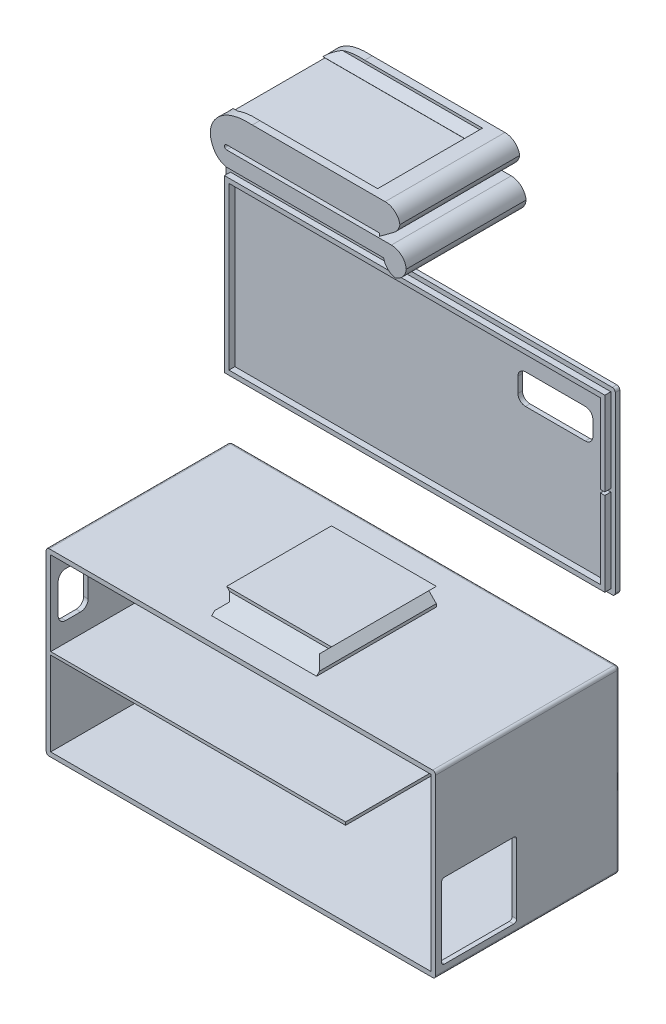
from build123d import *

# Parameters (mm, degrees)
CROQUIS1_W              = 60
CROQUIS1_H              = 130
SALIENTE_EXTRUIR1_DEPTH = 1.5
CROQUIS2_W              = 130
CROQUIS2_H              = 60
CROQUIS2_W_2            = 127
CROQUIS2_H_2            = 28
SALIENTE_EXTRUIR2_DEPTH = 60
CORTAR_EXTRUIR1_DEPTH   = 2
CROQUIS4_W              = 127
CROQUIS4_H              = 6
CROQUIS4_H_2            = 20.4
SALIENTE_EXTRUIR3_DEPTH = 3
CORTAR_EXTRUIR2_DEPTH   = 3
CROQUIS6_W              = 60
CROQUIS6_H              = 130
SALIENTE_EXTRUIR4_DEPTH = 1.5
CROQUIS7_W              = 127
CROQUIS7_H              = 57
CROQUIS7_W_2            = 124
CROQUIS7_H_2            = 54
SALIENTE_EXTRUIR5_DEPTH = 2
CORTAR_EXTRUIR3_DEPTH   = 2
CROQUIS9_W              = 1.5
CROQUIS9_H              = 1.02
CORTAR_EXTRUIR4_DEPTH   = 2
CORTAR_EXTRUIR5_DEPTH   = 2
REDONDEO1_R             = 1
REDONDEO2_R             = 1
CROQUIS11_W             = 35
CROQUIS11_H             = 35
SALIENTE_EXTRUIR8_DEPTH = 6
CORTAR_EXTRUIR7_DEPTH   = 45
CHAFL_N1_SIZE           = 5
SALIENTE_EXTRUIR9_DEPTH = 40
CORTAR_EXTRUIR8_START   = -10
CORTAR_EXTRUIR8_DEPTH   = 60
REDONDEO3_R             = 5


with BuildPart() as part:
    # Croquis1 → Saliente-Extruir1 (new body)
    with BuildSketch(Plane(origin=(0, 0, 0), x_dir=(0, 1, 0), z_dir=(0, 0, 1))):
        Rectangle(CROQUIS1_W, CROQUIS1_H)
    extrude(amount=SALIENTE_EXTRUIR1_DEPTH)

    # Croquis2 → Saliente-Extruir2 (add)
    with BuildSketch(Plane.XY.offset(1.5)):
        Rectangle(CROQUIS2_W, CROQUIS2_H)
        with Locations((0, 14.5)):
            Rectangle(CROQUIS2_W_2, CROQUIS2_H_2, mode=Mode.SUBTRACT)
        with Locations((0, -14.5)):
            Rectangle(CROQUIS2_W_2, CROQUIS2_H_2, mode=Mode.SUBTRACT)
    extrude(amount=SALIENTE_EXTRUIR2_DEPTH)

    # Croquis3 → Cortar-Extruir1 (cut)
    with BuildSketch(Plane(origin=(0, 0.5, 0), x_dir=(-1, 0, 0), z_dir=(0, 1, 0))):
        with BuildLine():
            Line((-63.5, 61.5), (-34.96028162, 61.5))
            Line((-34.96028162, 61.5), (-34.96028162, 31.5))
            ThreePointArc((-34.96028162, 31.5), (-37.889213808, 24.428932188), (-44.96028162, 21.5))
            Line((-44.96028162, 21.5), (-53.5, 21.5))
            ThreePointArc((-53.5, 21.5), (-60.571067812, 24.428932188), (-63.5, 31.5))
            Line((-63.5, 31.5), (-63.5, 61.5))
        make_face()
    extrude(amount=-CORTAR_EXTRUIR1_DEPTH, mode=Mode.SUBTRACT)

    # Croquis4 → Saliente-Extruir3 (add)
    with BuildSketch(Plane.XY.offset(1.5)):
        with Locations((0, -3.5)):
            Rectangle(CROQUIS4_W, CROQUIS4_H)
        with Locations((0, -18.3)):
            Rectangle(CROQUIS4_W, CROQUIS4_H_2)
    extrude(amount=SALIENTE_EXTRUIR3_DEPTH)

    # Croquis5 → Cortar-Extruir2 (cut)
    with BuildSketch(Plane(origin=(-65, 0, 0), x_dir=(0, -1, 0), z_dir=(-1, 0, 0))):
        with BuildLine():
            Line((-9.5, 49), (-19.5, 49))
            ThreePointArc((-19.5, 49), (-21.267766953, 49.732233047), (-22, 51.5))
            Line((-22, 51.5), (-22, 56.5))
            ThreePointArc((-22, 56.5), (-21.267766953, 58.267766953), (-19.5, 59))
            Line((-19.5, 59), (-9.5, 59))
            ThreePointArc((-9.5, 59), (-7.732233047, 58.267766953), (-7, 56.5))
            Line((-7, 56.5), (-7, 51.5))
            ThreePointArc((-7, 51.5), (-7.732233047, 49.732233047), (-9.5, 49))
        make_face()
    extrude(amount=-CORTAR_EXTRUIR2_DEPTH, mode=Mode.SUBTRACT)

    # Croquis10 → Cortar-Extruir5 (cut)
    with BuildSketch(Plane.YZ.offset(65)):
        with BuildLine():
            Line((-2.95, 34.41391254), (-26.05, 34.41391254))
            ThreePointArc((-26.05, 34.41391254), (-26.757106781, 34.706805759), (-27.05, 35.41391254))
            Line((-27.05, 35.41391254), (-27.05, 58.51391254))
            ThreePointArc((-27.05, 58.51391254), (-26.757106781, 59.221019322), (-26.05, 59.51391254))
            Line((-26.05, 59.51391254), (-2.95, 59.51391254))
            ThreePointArc((-2.95, 59.51391254), (-2.242893219, 59.221019322), (-1.95, 58.51391254))
            Line((-1.95, 58.51391254), (-1.95, 35.41391254))
            ThreePointArc((-1.95, 35.41391254), (-2.242893219, 34.706805759), (-2.95, 34.41391254))
        make_face()
    extrude(amount=-CORTAR_EXTRUIR5_DEPTH, mode=Mode.SUBTRACT)

    # Redondeo1
    redondeo1_edges = [part.edges().sort_by_distance(p)[0] for p in [
        (-65, 0, 0),
        (0, 30, 0),
        (65, 0, 0),
        (0, -30, 0),
        (-65, -30, 30.75),
        (-65, 30, 30.75),
        (65, 30, 30.75),
        (65, -30, 30.75),
    ]]
    fillet(redondeo1_edges, radius=REDONDEO1_R)

    # Croquis11 → Saliente-Extruir8 (add)
    with BuildSketch(Plane(origin=(0, 30, 0), x_dir=(-1, 0, 0), z_dir=(0, 1, 0))):
        with Locations((0, 31.25)):
            Rectangle(CROQUIS11_W, CROQUIS11_H)
    extrude(amount=SALIENTE_EXTRUIR8_DEPTH)

    # Croquis15 → Cortar-Extruir7 (cut)
    with BuildSketch(Plane.XY.offset(48.75)):
        Polygon((-17.5, 36), (-15, 33.5), (-17.5, 31), align=None)
    cortar_extruir7 = extrude(amount=-CORTAR_EXTRUIR7_DEPTH, mode=Mode.SUBTRACT)

    # Simetría1: Cortar-Extruir7 across plane
    add(cortar_extruir7.mirror(Plane(origin=(0, 0, 0), x_dir=(0, 0, 1), z_dir=(1, 0, 0))), mode=Mode.SUBTRACT)

    # Chaflán1
    # the kernel refuses this chamfer: 5 mm, written as the material it adds along each edge
    with BuildSketch(Plane(origin=(17.5, 30, 48.75), x_dir=(0, -0.027495876610586317, 0.9996219169112968), z_dir=(-1, 0, 0))) as chafl_n1_piece_1_section:
        Polygon((CHAFL_N1_SIZE * 0.999621916911, CHAFL_N1_SIZE * 0.0274958766106), (-CHAFL_N1_SIZE * 0.0274958766106, CHAFL_N1_SIZE * 0.999621916911), (0, 0), align=None)
    chafl_n1_piece_1 = extrude(amount=35, mode=Mode.PRIVATE)
    chafl_n1_piece_1 = split(chafl_n1_piece_1, bisect_by=Plane(origin=(15.432245285, 33.932245285, 48.975102949), z_dir=(-0.7071067811865482, 0.7071067811865468, 0)), keep=Keep.TOP, mode=Mode.PRIVATE)
    chafl_n1_piece_1 = split(chafl_n1_piece_1, bisect_by=Plane(origin=(14.567754715, 33.932245285, 48.975102949), z_dir=(0.7071067811865462, 0.7071067811865488, 0)), keep=Keep.TOP, mode=Mode.PRIVATE)
    add(chafl_n1_piece_1)
    with BuildSketch(Plane(origin=(17.5, 30, 48.75), x_dir=(0, -0.027495876610586317, 0.9996219169112968), z_dir=(-1, 0, 0))) as chafl_n1_piece_2_section:
        Polygon((CHAFL_N1_SIZE * 0.999621916911, CHAFL_N1_SIZE * 0.0274958766106), (-CHAFL_N1_SIZE * 0.0274958766106, CHAFL_N1_SIZE * 0.999621916911), (0, 0), align=None)
    chafl_n1_piece_2 = extrude(amount=35, mode=Mode.PRIVATE)
    chafl_n1_piece_2 = split(chafl_n1_piece_2, bisect_by=Plane(origin=(13.632899662, 32.132899662, 50.773714866), z_dir=(0.7071067811865482, -0.7071067811865468, 0)), keep=Keep.TOP, mode=Mode.PRIVATE)
    chafl_n1_piece_2 = split(chafl_n1_piece_2, bisect_by=Plane(origin=(16.189237839, 32.310762161, 50.773714866), z_dir=(-0.7071067811865462, -0.7071067811865488, 0)), keep=Keep.TOP, mode=Mode.PRIVATE)
    add(chafl_n1_piece_2)
    with BuildSketch(Plane(origin=(17.5, 30, 48.75), x_dir=(0, -0.027495876610586317, 0.9996219169112968), z_dir=(-1, 0, 0))) as chafl_n1_piece_3_section:
        Polygon((CHAFL_N1_SIZE * 0.999621916911, CHAFL_N1_SIZE * 0.0274958766106), (-CHAFL_N1_SIZE * 0.0274958766106, CHAFL_N1_SIZE * 0.999621916911), (0, 0), align=None)
    chafl_n1_piece_3 = extrude(amount=35, mode=Mode.PRIVATE)
    chafl_n1_piece_3 = split(chafl_n1_piece_3, bisect_by=Plane(origin=(-8.376980727, 40.123019273, 50.346819727), z_dir=(0.7071067811865462, -0.7071067811865488, 0)), keep=Keep.TOP, mode=Mode.PRIVATE)
    chafl_n1_piece_3 = split(chafl_n1_piece_3, bisect_by=Plane(origin=(-6.623019273, 25.123019273, 50.346819727), z_dir=(0.7071067811865482, 0.7071067811865468, 0)), keep=Keep.TOP, mode=Mode.PRIVATE)
    chafl_n1_piece_3 = split(chafl_n1_piece_3, bisect_by=Plane(origin=(6.623019273, 25.123019273, 50.346819727), z_dir=(-0.7071067811865482, 0.7071067811865468, 0)), keep=Keep.TOP, mode=Mode.PRIVATE)
    chafl_n1_piece_3 = split(chafl_n1_piece_3, bisect_by=Plane(origin=(8.376980727, 40.123019273, 50.346819727), z_dir=(-0.7071067811865462, -0.7071067811865488, 0)), keep=Keep.TOP, mode=Mode.PRIVATE)
    add(chafl_n1_piece_3)
    with BuildSketch(Plane(origin=(17.5, 30, 48.75), x_dir=(0, -0.027495876610586317, 0.9996219169112968), z_dir=(-1, 0, 0))) as chafl_n1_piece_4_section:
        Polygon((CHAFL_N1_SIZE * 0.999621916911, CHAFL_N1_SIZE * 0.0274958766106), (-CHAFL_N1_SIZE * 0.0274958766106, CHAFL_N1_SIZE * 0.999621916911), (0, 0), align=None)
    chafl_n1_piece_4 = extrude(amount=35, mode=Mode.PRIVATE)
    chafl_n1_piece_4 = split(chafl_n1_piece_4, bisect_by=Plane(origin=(-14.567754715, 33.932245285, 48.975102949), z_dir=(-0.7071067811865462, 0.7071067811865488, 0)), keep=Keep.TOP, mode=Mode.PRIVATE)
    chafl_n1_piece_4 = split(chafl_n1_piece_4, bisect_by=Plane(origin=(-15.432245285, 33.932245285, 48.975102949), z_dir=(0.7071067811865482, 0.7071067811865468, 0)), keep=Keep.TOP, mode=Mode.PRIVATE)
    add(chafl_n1_piece_4)
    with BuildSketch(Plane(origin=(17.5, 30, 48.75), x_dir=(0, -0.027495876610586317, 0.9996219169112968), z_dir=(-1, 0, 0))) as chafl_n1_piece_5_section:
        Polygon((CHAFL_N1_SIZE * 0.999621916911, CHAFL_N1_SIZE * 0.0274958766106), (-CHAFL_N1_SIZE * 0.0274958766106, CHAFL_N1_SIZE * 0.999621916911), (0, 0), align=None)
    chafl_n1_piece_5 = extrude(amount=35, mode=Mode.PRIVATE)
    chafl_n1_piece_5 = split(chafl_n1_piece_5, bisect_by=Plane(origin=(-16.189237839, 32.310762161, 50.773714866), z_dir=(0.7071067811865462, -0.7071067811865488, 0)), keep=Keep.TOP, mode=Mode.PRIVATE)
    chafl_n1_piece_5 = split(chafl_n1_piece_5, bisect_by=Plane(origin=(-13.632899662, 32.132899662, 50.773714866), z_dir=(-0.7071067811865482, -0.7071067811865468, 0)), keep=Keep.TOP, mode=Mode.PRIVATE)
    add(chafl_n1_piece_5)


with BuildPart() as body_2:
    # Croquis6 → Saliente-Extruir4 (new body)
    with BuildSketch(Plane(origin=(0, 0, 0), x_dir=(0, 1, 0), z_dir=(0, 0, 1))):
        with Locations((80.653942152, 0)):
            Rectangle(CROQUIS6_W, CROQUIS6_H)
    extrude(amount=SALIENTE_EXTRUIR4_DEPTH)

    # Croquis7 → Saliente-Extruir5 (add)
    with BuildSketch(Plane.XY.offset(1.5)):
        with Locations((0, 80.653942152)):
            Rectangle(CROQUIS7_W, CROQUIS7_H)
        with Locations((0, 80.653942152)):
            Rectangle(CROQUIS7_W_2, CROQUIS7_H_2, mode=Mode.SUBTRACT)
    extrude(amount=SALIENTE_EXTRUIR5_DEPTH)

    # Croquis8 → Cortar-Extruir3 (cut)
    with BuildSketch(Plane(origin=(0, 0, 0), x_dir=(1, 0, 0), z_dir=(0, 0, -1))):
        with BuildLine():
            Line((55, -100.653942152), (35, -100.653942152))
            ThreePointArc((35, -100.653942152), (33.232233047, -99.921709105), (32.5, -98.153942152))
            Line((32.5, -98.153942152), (32.5, -93.153942152))
            ThreePointArc((32.5, -93.153942152), (33.232233047, -91.386175199), (35, -90.653942152))
            Line((35, -90.653942152), (55, -90.653942152))
            ThreePointArc((55, -90.653942152), (56.767766953, -91.386175199), (57.5, -93.153942152))
            Line((57.5, -93.153942152), (57.5, -98.153942152))
            ThreePointArc((57.5, -98.153942152), (56.767766953, -99.921709105), (55, -100.653942152))
        make_face()
    extrude(amount=-CORTAR_EXTRUIR3_DEPTH, mode=Mode.SUBTRACT)

    # Croquis9 → Cortar-Extruir4 (cut)
    with BuildSketch(Plane.XY.offset(3.5)):
        with Locations((62.75, 80.653942152)):
            Rectangle(CROQUIS9_W, CROQUIS9_H)
    extrude(amount=-CORTAR_EXTRUIR4_DEPTH, mode=Mode.SUBTRACT)

    # Redondeo2
    redondeo2_edges = [body_2.edges().sort_by_distance(p)[0] for p in [
        (-65, 50.653942152, 0.75),
        (-65, 110.653942152, 0.75),
        (65, 110.653942152, 0.75),
        (65, 50.653942152, 0.75),
    ]]
    fillet(redondeo2_edges, radius=REDONDEO2_R)


with BuildPart() as body_3:
    # Croquis16 → Saliente-Extruir9 (new body)
    with BuildSketch(Plane(origin=(0, 0, 0), x_dir=(0, 1, 0), z_dir=(0, 0, 1))):
        with BuildLine():
            Line((153.430673644, 26.257303068), (153.430673644, -33.742696932))
            Line((153.430673644, -33.742696932), (148.430673644, -33.742696932))
            Line((148.430673644, -33.742696932), (144.430673644, -33.742696932))
            Line((144.430673644, -33.742696932), (144.430673644, -26.146137696))
            Line((144.430673644, -26.146137696), (148.430673644, -26.146137696))
            Line((148.430673644, -26.146137696), (148.430673644, 26.257303068))
            add(Edge.make_bspline(
                [(148.430673644, 26.257303068), (148.912637058, 29.212828549), (152.01078713, 31.303928812), (159.394447974, 32.276943324), (165.570615176, 27.287591474), (164.930673644, 17.6884685)],
                knots=[0, 0, 0, 0, 0.351905176, 0.430580995, 1, 1, 1, 1], degree=3))
            Line((164.930673644, 17.6884685), (164.930673644, -31.650384498))
            Line((164.930673644, -31.650384498), (159.061976165, -31.650384498))
            Line((159.061976165, -31.650384498), (153.930673644, -24.742696932))
            Line((153.930673644, -24.742696932), (154.930673644, -24.742696932))
            Line((154.930673644, -24.742696932), (154.930673644, 26.257303068))
            ThreePointArc((154.930673644, 26.257303068), (154.180673644, 27.007303068), (153.430673644, 26.257303068))
        make_face()
    extrude(amount=SALIENTE_EXTRUIR9_DEPTH)

    # Croquis17 → Cortar-Extruir8 (cut)
    with BuildSketch(Plane.YZ.offset(31.650384498).offset(CORTAR_EXTRUIR8_START)):
        Polygon((158.930673644, 37.5), (161.480673644, 34.99), (164.030673644, 37.5), (168.412676556, 37.5), (168.412676556, 2.5), (164.030673644, 2.5), (161.480673644, 5.01), (158.930673644, 2.5), align=None)
    extrude(amount=-CORTAR_EXTRUIR8_DEPTH, mode=Mode.SUBTRACT)

    # Redondeo3
    # the kernel refuses this fillet: 5 mm, written as the material it takes off along each edge
    with BuildSketch(Plane(origin=(26.146137696, 144.430673644, -12.247448714), x_dir=(1, 0, 0), z_dir=(0, 0, 1))) as redondeo3_piece_1:
        with BuildLine():
            CenterArc((4.898979486, 5), REDONDEO3_R, 191.536959033, 78.463040967)
            Line((0, 4), (-0.09797959, 3.98))
            ThreePointArc((-0.09797959, 3.98), (-0.1, 2), (-0.1, 0))
            Line((-0.1, 0), (0, -0.1))
            Line((0, -0.1), (4.898979486, -0.1))
            Line((4.898979486, -0.1), (4.898979486, 0))
        make_face()
    extrude(amount=64.494897428, mode=Mode.SUBTRACT)
    with BuildSketch(Plane(origin=(33.742696932, 144.430673644, -12.5), x_dir=(0, 1, 0), z_dir=(0, 0, 1)), Plane(origin=(33.742696932, 153.430673644, -12.5), x_dir=(-1, 0, 0), z_dir=(0, 0, 1)), Plane(origin=(31.650384498, 164.930673644, -12.5), x_dir=(-1, 0, 0), z_dir=(0, 0, 1))) as redondeo3_piece_2:
        with BuildLine():
            CenterArc((REDONDEO3_R, REDONDEO3_R), REDONDEO3_R, 180, 90)
            Line((0, REDONDEO3_R), (-REDONDEO3_R * 0.02, REDONDEO3_R))
            Line((-REDONDEO3_R * 0.02, REDONDEO3_R), (-REDONDEO3_R * 0.02, -REDONDEO3_R * 0.02))
            Line((-REDONDEO3_R * 0.02, -REDONDEO3_R * 0.02), (REDONDEO3_R, -REDONDEO3_R * 0.02))
            Line((REDONDEO3_R, -REDONDEO3_R * 0.02), (REDONDEO3_R, 0))
        make_face()
    extrude(amount=65, mode=Mode.SUBTRACT)
    with BuildSketch(Plane(origin=(31.650384498, 159.061976165, -6.285967617), x_dir=(0, 1, 0), z_dir=(0, 0, 1))) as redondeo3_piece_3:
        with BuildLine():
            CenterArc((REDONDEO3_R * 0.502877409395, REDONDEO3_R), REDONDEO3_R, 216.606419901, 53.393580099)
            Line((-REDONDEO3_R * 0.299873254705, REDONDEO3_R * 0.403685174353), (-REDONDEO3_R * 0.315928267987, REDONDEO3_R * 0.39175887784))
            Line((-REDONDEO3_R * 0.315928267987, REDONDEO3_R * 0.39175887784), (-REDONDEO3_R * 0.0100575481879, -REDONDEO3_R * 0.02))
            Line((-REDONDEO3_R * 0.0100575481879, -REDONDEO3_R * 0.02), (REDONDEO3_R * 0.502877409395, -REDONDEO3_R * 0.02))
            Line((REDONDEO3_R * 0.502877409395, -REDONDEO3_R * 0.02), (REDONDEO3_R * 0.502877409395, 0))
        make_face()
    extrude(amount=52.571935235, mode=Mode.SUBTRACT)


solid = Compound([part.part, body_2.part, body_3.part])
